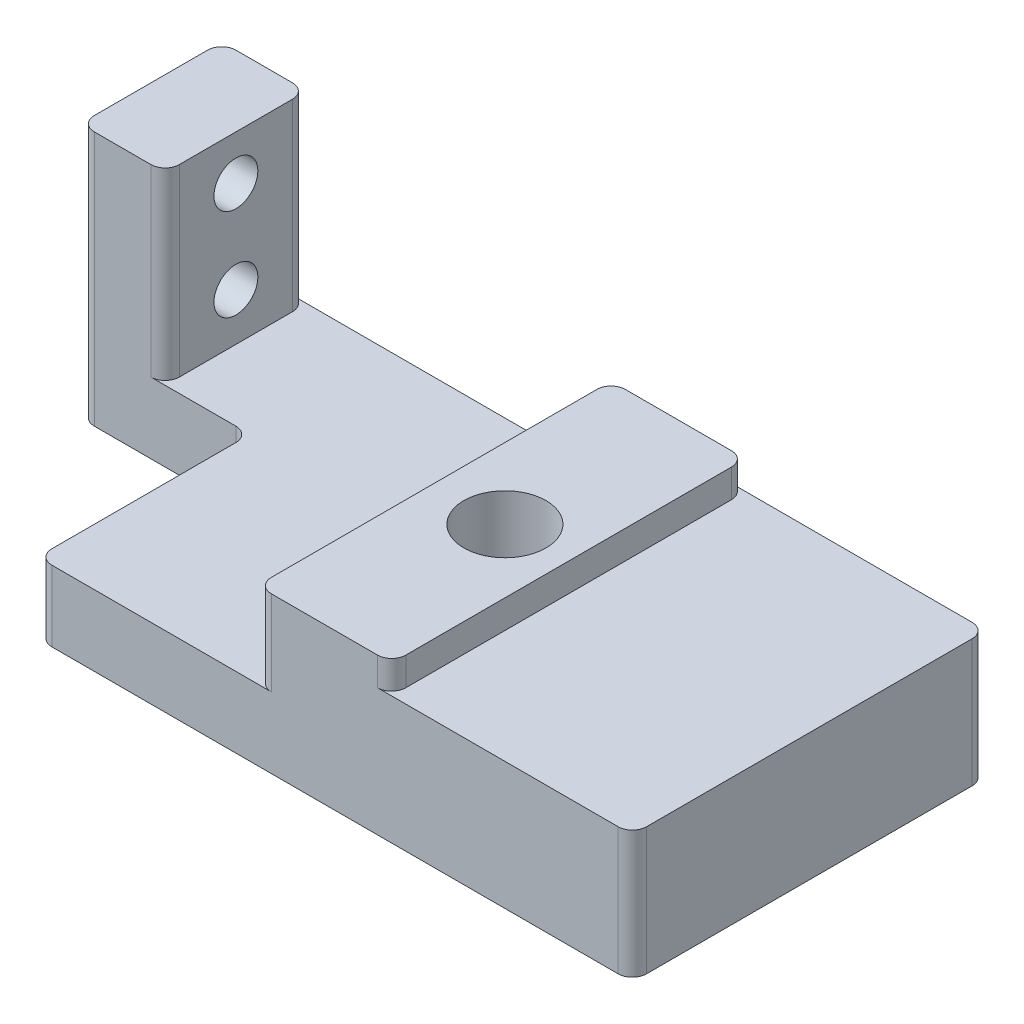
from build123d import *

# Parameters (mm, degrees)
SKETCH1_W                  = 45
SKETCH1_H                  = 25
BOSS_EXTRUDE1_DEPTH        = 5
SKETCH5_W                  = 26.5
SKETCH5_H                  = 25
BOSS_EXTRUDE3_DEPTH        = 4
SKETCH11_W                 = 9.5
SKETCH11_H                 = 25
BOSS_EXTRUDE5_DEPTH        = 2
SKETCH12_W                 = 3
SKETCH12_H                 = 25
CUT_EXTRUDE2_DEPTH         = 52.826634079
M5_CLEARANCE_HOLE1_D       = 5.8
BOSS_EXTRUDE8_DEPTH        = 10
M2_5_CLEARANCE_HOLE1_D     = 3.1
M2_5_CLEARANCE_HOLE1_DEPTH = 6
M2_5_CLEARANCE_HOLE1_TIP   = 0.931333959
FILLET2_R                  = 1


with BuildPart() as part:
    # Sketch1 → Boss-Extrude1 (new body)
    with BuildSketch(Plane(origin=(0, 0, 0), x_dir=(1, 0, 0), z_dir=(0, 1, 0))):
        with Locations((22.5, 12.5)):
            Rectangle(SKETCH1_W, SKETCH1_H)
    extrude(amount=BOSS_EXTRUDE1_DEPTH)

    # Sketch5 → Boss-Extrude3 (add)
    with BuildSketch(Plane(origin=(0, 5, 0), x_dir=(1, 0, 0), z_dir=(0, 1, 0))):
        with Locations((31.75, 12.5)):
            Rectangle(SKETCH5_W, SKETCH5_H)
    extrude(amount=BOSS_EXTRUDE3_DEPTH)

    # Sketch11 → Boss-Extrude5 (add)
    with BuildSketch(Plane(origin=(0, 9, 0), x_dir=(1, 0, 0), z_dir=(0, 1, 0))):
        with Locations((23.25, 12.5)):
            Rectangle(SKETCH11_W, SKETCH11_H)
    extrude(amount=BOSS_EXTRUDE5_DEPTH)

    # Sketch12 → Cut-Extrude2 (cut, through all)
    with BuildSketch(Plane(origin=(0, 5, 0), x_dir=(1, 0, 0), z_dir=(0, 1, 0))):
        with Locations((1.5, 12.5)):
            Rectangle(SKETCH12_W, SKETCH12_H)
    extrude(amount=-CUT_EXTRUDE2_DEPTH, mode=Mode.SUBTRACT)

    # M5 Clearance Hole1 (through all)
    with Locations(Plane(origin=(0, 0, 0), x_dir=(-1, 0, 0), z_dir=(0, -1, 0))):
        with Locations((-23.5, 12.5)):
            Hole(M5_CLEARANCE_HOLE1_D / 2)

    # Sketch18 → Boss-Extrude8 (add)
    with BuildSketch(Plane(origin=(0, 0, -25), x_dir=(-1, 0, 0), z_dir=(0, 0, -1))):
        Polygon((-3, 0), (9, 0), (9, 18), (3, 18), (3, 5), (-3, 5), align=None)
    extrude(amount=-BOSS_EXTRUDE8_DEPTH)

    # M2.5 Clearance Hole1
    with Locations(Plane.ZY.offset(9)):
        with Locations((-20, 14.85), (-20, 8.35)):
            Hole(M2_5_CLEARANCE_HOLE1_D / 2, depth=M2_5_CLEARANCE_HOLE1_DEPTH)
            with Locations((0, 0, -(M2_5_CLEARANCE_HOLE1_DEPTH + M2_5_CLEARANCE_HOLE1_TIP / 2))):  # 118° drill point
                Cone(0, M2_5_CLEARANCE_HOLE1_D / 2, M2_5_CLEARANCE_HOLE1_TIP, mode=Mode.SUBTRACT)

    # Fillet2
    fillet2_edges = [part.edges().sort_by_distance(p)[0] for p in [
        (28, 10, 0),
        (18.5, 8, 0),
        (18.5, 8, -25),
        (28, 10, -25),
        (3, 2.5, 0),
        (45, 4.5, 0),
        (45, 4.5, -25),
        (-3, 11.5, -25),
        (-9, 9, -25),
        (-3, 11.5, -15),
        (-9, 9, -15),
        (3, 2.5, -15),
    ]]
    fillet(fillet2_edges, radius=FILLET2_R)


solid = part.part
